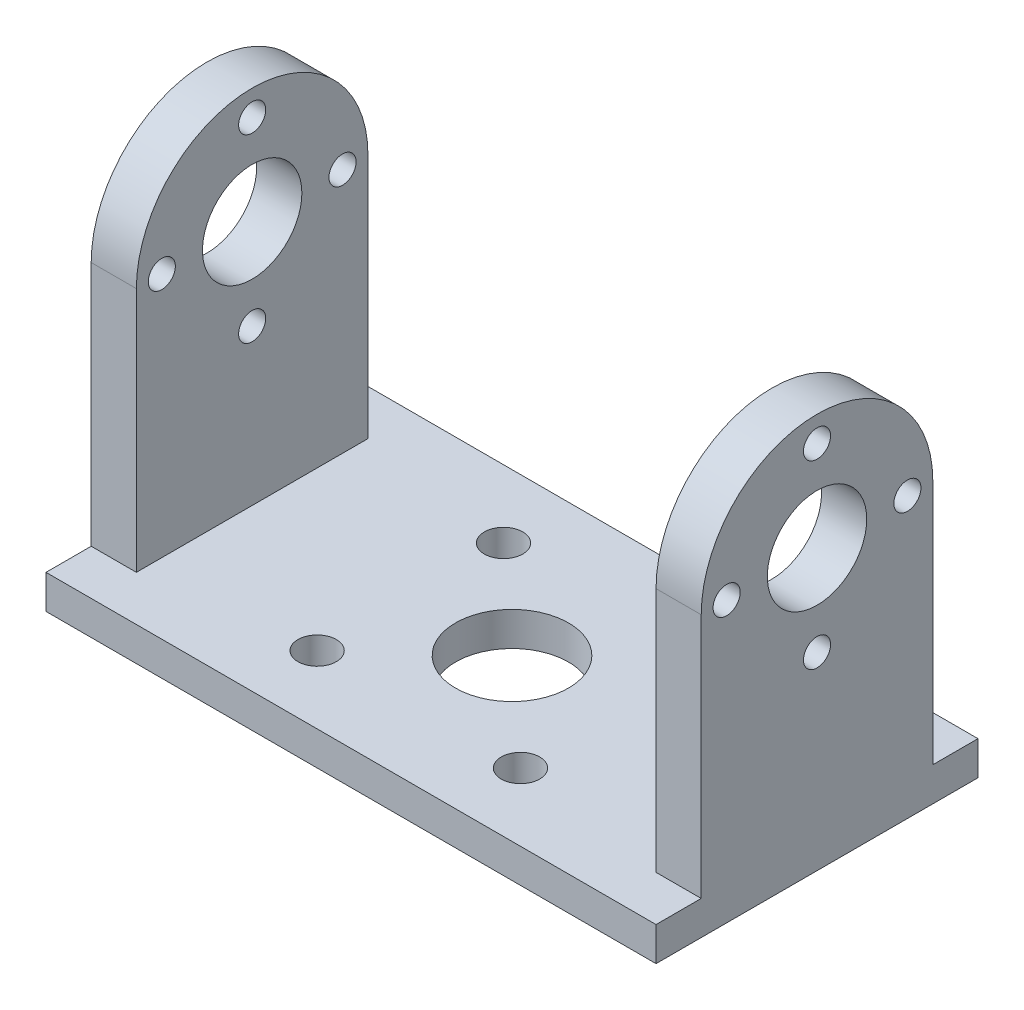
from build123d import *

# Parameters (mm, degrees)
SKETCH1_W           = 54
SKETCH1_H           = 28.5
SKETCH1_R           = 1.7
SKETCH1_R_2         = 5
BOSS_EXTRUDE2_DEPTH = 3
SKETCH2_W           = 4
SKETCH2_H           = 20.5
BOSS_EXTRUDE3_DEPTH = 21.75
SKETCH4_R           = 10.25
BOSS_EXTRUDE4_DEPTH = 4
SKETCH6_R           = 4.4
SKETCH6_R_2         = 1.2
CUT_EXTRUDE3_DEPTH  = 4


with BuildPart() as part:
    # Sketch1 → Boss-Extrude2 (new body)
    with BuildSketch(Plane(origin=(0, 0, 0), x_dir=(1, 0, 0), z_dir=(0, 1, 0))):
        Rectangle(SKETCH1_W, SKETCH1_H)
        with Locations((-9, -8.25)):
            Circle(SKETCH1_R, mode=Mode.SUBTRACT)
        with Locations((9, -8.25)):
            Circle(SKETCH1_R, mode=Mode.SUBTRACT)
        with Locations((-9, 8.25)):
            Circle(SKETCH1_R, mode=Mode.SUBTRACT)
        Circle(SKETCH1_R_2, mode=Mode.SUBTRACT)
        with Locations((9, 8.25)):
            Circle(SKETCH1_R, mode=Mode.SUBTRACT)
    extrude(amount=BOSS_EXTRUDE2_DEPTH)

    # Sketch2 → Boss-Extrude3 (add)
    with BuildSketch(Plane(origin=(0, 3, 0), x_dir=(1, 0, 0), z_dir=(0, 1, 0))):
        with Locations((25, 0)):
            Rectangle(SKETCH2_W, SKETCH2_H)
    boss_extrude3 = extrude(amount=BOSS_EXTRUDE3_DEPTH)

    # Sketch4 → Boss-Extrude4 (add)
    with BuildSketch(Plane(origin=(27, 0, 0), x_dir=(0, 0, -1), z_dir=(1, 0, 0))):
        with Locations((0, 24.75)):
            Circle(SKETCH4_R)
    boss_extrude4 = extrude(amount=-BOSS_EXTRUDE4_DEPTH)

    # Mirror1: Boss-Extrude3, Boss-Extrude4 across plane
    add(boss_extrude3.mirror(Plane(origin=(0, 0, 0), x_dir=(0, 0, 1), z_dir=(1, 0, 0))))
    add(boss_extrude4.mirror(Plane(origin=(0, 0, 0), x_dir=(0, 0, 1), z_dir=(1, 0, 0))))

    # Sketch6 → Cut-Extrude3 (cut)
    with BuildSketch(Plane(origin=(27, 0, 0), x_dir=(0, 0, -1), z_dir=(1, 0, 0))):
        with Locations((0, 24.75)):
            Circle(SKETCH6_R)
        with Locations((8, 24.75)):
            Circle(SKETCH6_R_2)
        with Locations((0, 32.75)):
            Circle(SKETCH6_R_2)
        with Locations((0, 16.75)):
            Circle(SKETCH6_R_2)
        with Locations((-8, 24.75)):
            Circle(SKETCH6_R_2)
    cut_extrude3 = extrude(amount=-CUT_EXTRUDE3_DEPTH, mode=Mode.SUBTRACT)

    # Mirror3: Cut-Extrude3 across plane
    add(cut_extrude3.mirror(Plane(origin=(0, 0, 0), x_dir=(0, 0, 1), z_dir=(1, 0, 0))), mode=Mode.SUBTRACT)


solid = part.part
